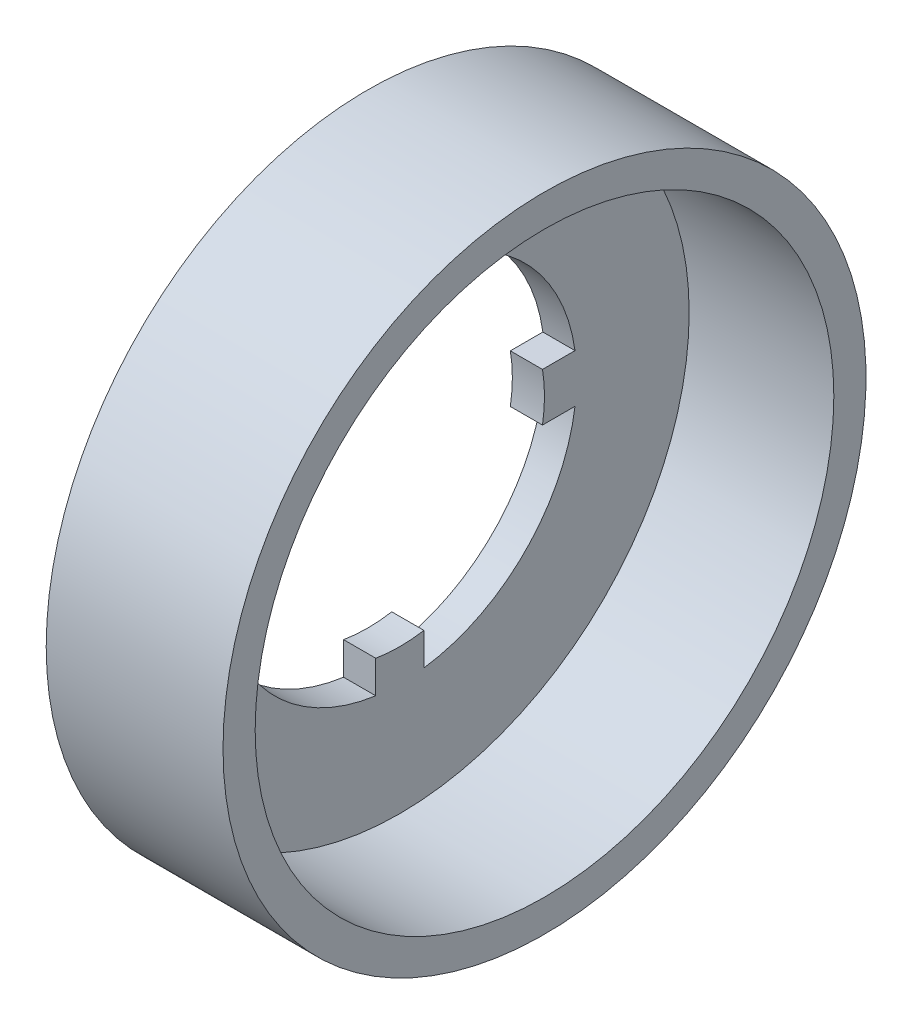
from build123d import *

# Parameters (mm, degrees)
ENL_V_MAT_EXTRU_1_DEPTH = 61.695963622


with BuildPart() as part:
    # Esquisse1 → Base-Révolution (revolve)
    with BuildSketch(Plane.XY):
        Polygon((0, 40), (0, 18), (4, 18), (4, 36), (22, 36), (22, 40), align=None)
    revolve(axis=Axis((0, 0, 0), (1, 0, 0)))

    # Esquisse2 → Enlèv. mat.-Extru.1 (cut, through all)
    with BuildSketch(Plane.ZY):
        with BuildLine():
            Line((-3, 16), (-3, 21.794494718))
            ThreePointArc((-3, 21.794494718), (-15.556349186, 15.556349186), (-21.794494718, 3))
            Line((-21.794494718, 3), (-16, 3))
            Line((-16, 3), (-16, -3))
            Line((-16, -3), (-21.794494718, -3))
            ThreePointArc((-21.794494718, -3), (-15.556349186, -15.556349186), (-3, -21.794494718))
            Line((-3, -21.794494718), (-3, -16))
            Line((-3, -16), (3, -16))
            Line((3, -16), (3, -21.794494718))
            ThreePointArc((3, -21.794494718), (15.556349186, -15.556349186), (21.794494718, -3))
            Line((21.794494718, -3), (16, -3))
            Line((16, -3), (16, 3))
            Line((16, 3), (21.794494718, 3))
            ThreePointArc((21.794494718, 3), (15.556349186, 15.556349186), (3, 21.794494718))
            Line((3, 21.794494718), (3, 16))
            Line((3, 16), (-3, 16))
        make_face()
    extrude(amount=-ENL_V_MAT_EXTRU_1_DEPTH, mode=Mode.SUBTRACT)


solid = part.part
